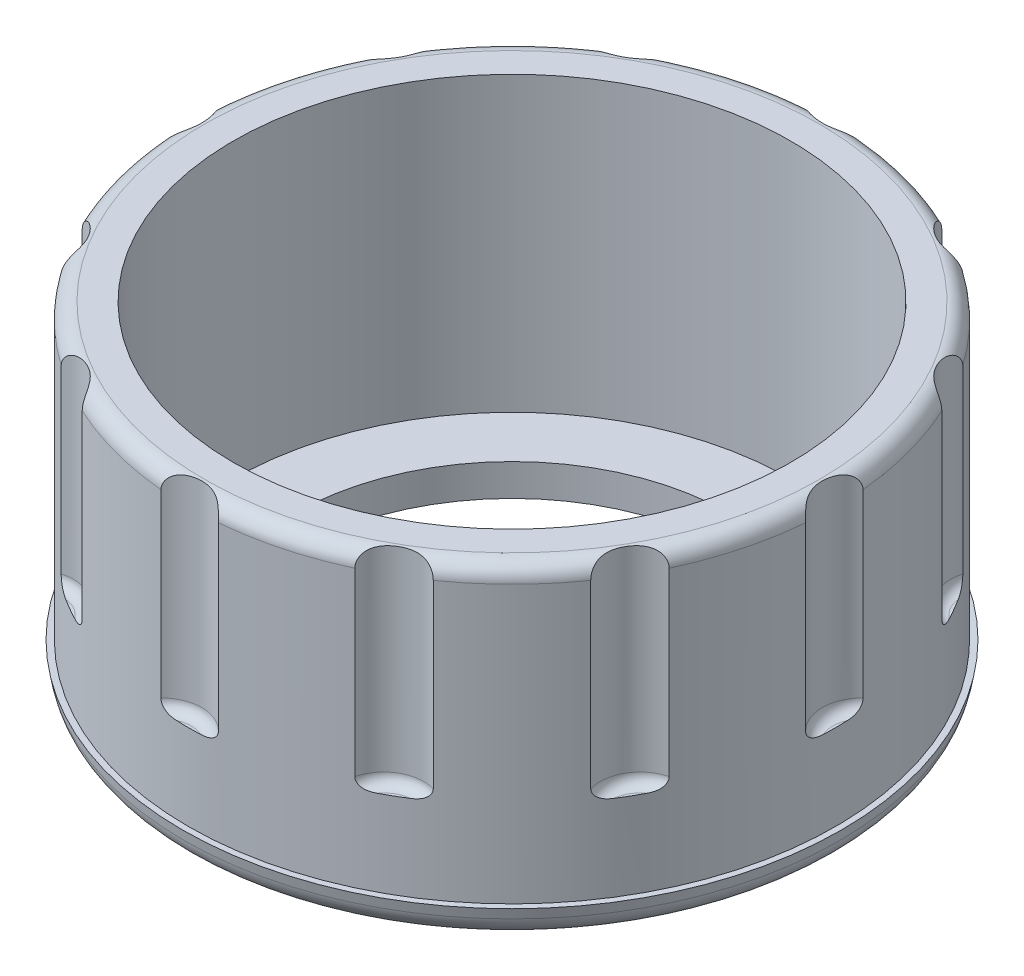
from build123d import *

# Parameters (mm, degrees)
SKETCH1_R                     = 15.4432
BOSS_EXTRUDE1_DEPTH           = 15.494
F_1_1_8_12_TAPPED_HOLE1_D     = 26.59126
F_1_1_8_12_TAPPED_HOLE1_DEPTH = 13.97
CUT_EXTRUDE1_START            = 15.494
SKETCH4_R                     = 1.905
CUT_EXTRUDE1_DEPTH            = 9.8806
FILLET2_R                     = 0.508
CIRPATTERN1_COUNT             = 12
FILLET2_OF_CIRPATTERN1_R      = 0.508
FILLET3_R                     = 0.762
SKETCH5_R                     = 10.414
CUT_EXTRUDE2_DEPTH            = 9.8806
FILLET4_R                     = 1.27


with BuildPart() as part:
    # Sketch1 → Boss-Extrude1 (new body)
    with BuildSketch(Plane(origin=(0, 0, 0), x_dir=(1, 0, 0), z_dir=(0, 1, 0))):
        with Locations(Location((0, 0, 0), (0, 0, 270))):
            Circle(SKETCH1_R)
    extrude(amount=BOSS_EXTRUDE1_DEPTH)

    # 1-1/8-12 Tapped Hole1
    with Locations(Plane(origin=(0, 15.494, 0), x_dir=(1, 0, 0), z_dir=(0, 1, 0))):
        with Locations((0, 0)):
            Hole(F_1_1_8_12_TAPPED_HOLE1_D / 2, depth=F_1_1_8_12_TAPPED_HOLE1_DEPTH)

    # Sketch4 → Cut-Extrude1 (cut)
    with BuildSketch(Plane(origin=(0, 0, 0), x_dir=(1, 0, 0), z_dir=(0, 1, 0)).offset(CUT_EXTRUDE1_START)):
        with Locations((0, 16.705203825)):
            Circle(SKETCH4_R)
    cut_extrude1 = extrude(amount=-CUT_EXTRUDE1_DEPTH, mode=Mode.SUBTRACT)

    # Fillet2
    fillet2_edges = [part.edges().sort_by_distance(p)[0] for p in [
        (0, 5.6134, -14.800203825),
    ]]
    fillet(fillet2_edges, radius=FILLET2_R)

    # CirPattern1: Cut-Extrude1 ×12 about axis
    cirpattern1_axis = Axis((0, 0, 0), (0, 1, 0))
    for i in range(1, CIRPATTERN1_COUNT):
        add(cut_extrude1.rotate(cirpattern1_axis, i * 360 / CIRPATTERN1_COUNT), mode=Mode.SUBTRACT)

    # Fillet2 of CirPattern1
    fillet2_of_cirpattern1_edges = [part.edges().sort_by_distance(p)[0] for p in [
        (-7.400101912, 5.6134, -12.817352494),
        (-12.817352494, 5.6134, -7.400101912),
        (-14.800203825, 5.6134, 0),
        (-12.817352494, 5.6134, 7.400101912),
        (-7.400101912, 5.6134, 12.817352494),
        (0, 5.6134, 14.800203825),
        (7.400101912, 5.6134, 12.817352494),
        (12.817352494, 5.6134, 7.400101912),
        (14.800203825, 5.6134, 0),
        (12.817352494, 5.6134, -7.400101912),
        (7.400101912, 5.6134, -12.817352494),
    ]]
    fillet(fillet2_of_cirpattern1_edges, radius=FILLET2_OF_CIRPATTERN1_R)

    # Fillet3
    # the kernel refuses this fillet: 0.762 mm, written as the material it takes off along each edge
    with BuildSketch(Plane(origin=(0, 15.494, 0), x_dir=(0.034476388157499746, 0, -0.9994055126221855), z_dir=(0.9994055126221855, 0, 0.034476388157499746))) as fillet3_piece_1:
        with BuildLine():
            CenterArc((15.4432 - FILLET3_R, -FILLET3_R), FILLET3_R, 0, 90)
            Line((15.4432 - FILLET3_R, 0), (15.4432, 0))
            Line((15.4432, 0), (15.4432, -FILLET3_R))
        make_face()
    revolve(axis=Axis((0, 15.494, 0), (0, 1, 0)), revolution_arc=33.951486136, mode=Mode.SUBTRACT)
    with BuildSketch(Plane(origin=(0, 15.494, 0), x_dir=(-0.4698453283359946, 0, -0.8827487566917562), z_dir=(0.8827487566917562, 0, -0.4698453283359946))) as fillet3_piece_2:
        with BuildLine():
            CenterArc((15.4432 - FILLET3_R, -FILLET3_R), FILLET3_R, 0, 90)
            Line((15.4432 - FILLET3_R, 0), (15.4432, 0))
            Line((15.4432, 0), (15.4432, -FILLET3_R))
        make_face()
    revolve(axis=Axis((0, 15.494, 0), (0, 1, 0)), revolution_arc=33.951486136, mode=Mode.SUBTRACT)
    with BuildSketch(Plane(origin=(0, 15.494, 0), x_dir=(-0.8482723685342893, 0, -0.5295601842861929), z_dir=(0.5295601842861929, 0, -0.8482723685342893))) as fillet3_piece_3:
        with BuildLine():
            CenterArc((15.4432 - FILLET3_R, -FILLET3_R), FILLET3_R, 0, 90)
            Line((15.4432 - FILLET3_R, 0), (15.4432, 0))
            Line((15.4432, 0), (15.4432, -FILLET3_R))
        make_face()
    revolve(axis=Axis((0, 15.494, 0), (0, 1, 0)), revolution_arc=33.951486136, mode=Mode.SUBTRACT)
    with BuildSketch(Plane(origin=(0, 15.494, 0), x_dir=(-0.9994055126221868, 0, -0.034476388157465204), z_dir=(0.034476388157465204, 0, -0.9994055126221868))) as fillet3_piece_4:
        with BuildLine():
            CenterArc((15.4432 - FILLET3_R, -FILLET3_R), FILLET3_R, 0, 90)
            Line((15.4432 - FILLET3_R, 0), (15.4432, 0))
            Line((15.4432, 0), (15.4432, -FILLET3_R))
        make_face()
    revolve(axis=Axis((0, 15.494, 0), (0, 1, 0)), revolution_arc=33.951486136, mode=Mode.SUBTRACT)
    with BuildSketch(Plane(origin=(0, 15.494, 0), x_dir=(-0.8827487566917557, 0, 0.46984532833599574), z_dir=(-0.46984532833599574, 0, -0.8827487566917557))) as fillet3_piece_5:
        with BuildLine():
            CenterArc((15.4432 - FILLET3_R, -FILLET3_R), FILLET3_R, 0, 90)
            Line((15.4432 - FILLET3_R, 0), (15.4432, 0))
            Line((15.4432, 0), (15.4432, -FILLET3_R))
        make_face()
    revolve(axis=Axis((0, 15.494, 0), (0, 1, 0)), revolution_arc=33.951486136, mode=Mode.SUBTRACT)
    with BuildSketch(Plane(origin=(0, 15.494, 0), x_dir=(-0.5295601842861937, 0, 0.8482723685342889), z_dir=(-0.8482723685342889, 0, -0.5295601842861937))) as fillet3_piece_6:
        with BuildLine():
            CenterArc((15.4432 - FILLET3_R, -FILLET3_R), FILLET3_R, 0, 90)
            Line((15.4432 - FILLET3_R, 0), (15.4432, 0))
            Line((15.4432, 0), (15.4432, -FILLET3_R))
        make_face()
    revolve(axis=Axis((0, 15.494, 0), (0, 1, 0)), revolution_arc=33.951486136, mode=Mode.SUBTRACT)
    with BuildSketch(Plane(origin=(0, 15.494, 0), x_dir=(-0.03447638815746288, 0, 0.9994055126221868), z_dir=(-0.9994055126221868, 0, -0.03447638815746288))) as fillet3_piece_7:
        with BuildLine():
            CenterArc((15.4432 - FILLET3_R, -FILLET3_R), FILLET3_R, 0, 90)
            Line((15.4432 - FILLET3_R, 0), (15.4432, 0))
            Line((15.4432, 0), (15.4432, -FILLET3_R))
        make_face()
    revolve(axis=Axis((0, 15.494, 0), (0, 1, 0)), revolution_arc=33.951486136, mode=Mode.SUBTRACT)
    with BuildSketch(Plane(origin=(0, 15.494, 0), x_dir=(0.4698453283359953, 0, 0.8827487566917558), z_dir=(-0.8827487566917558, 0, 0.4698453283359953))) as fillet3_piece_8:
        with BuildLine():
            CenterArc((15.4432 - FILLET3_R, -FILLET3_R), FILLET3_R, 0, 90)
            Line((15.4432 - FILLET3_R, 0), (15.4432, 0))
            Line((15.4432, 0), (15.4432, -FILLET3_R))
        make_face()
    revolve(axis=Axis((0, 15.494, 0), (0, 1, 0)), revolution_arc=33.951486136, mode=Mode.SUBTRACT)
    with BuildSketch(Plane(origin=(0, 15.494, 0), x_dir=(0.8482723685342883, 0, 0.5295601842861947), z_dir=(-0.5295601842861947, 0, 0.8482723685342883))) as fillet3_piece_9:
        with BuildLine():
            CenterArc((15.4432 - FILLET3_R, -FILLET3_R), FILLET3_R, 0, 90)
            Line((15.4432 - FILLET3_R, 0), (15.4432, 0))
            Line((15.4432, 0), (15.4432, -FILLET3_R))
        make_face()
    revolve(axis=Axis((0, 15.494, 0), (0, 1, 0)), revolution_arc=33.951486136, mode=Mode.SUBTRACT)
    with BuildSketch(Plane(origin=(0, 15.494, 0), x_dir=(0.9994055126221867, 0, 0.03447638815746685), z_dir=(-0.03447638815746685, 0, 0.9994055126221867))) as fillet3_piece_10:
        with BuildLine():
            CenterArc((15.4432 - FILLET3_R, -FILLET3_R), FILLET3_R, 0, 90)
            Line((15.4432 - FILLET3_R, 0), (15.4432, 0))
            Line((15.4432, 0), (15.4432, -FILLET3_R))
        make_face()
    revolve(axis=Axis((0, 15.494, 0), (0, 1, 0)), revolution_arc=33.951486136, mode=Mode.SUBTRACT)
    with BuildSketch(Plane(origin=(0, 15.494, 0), x_dir=(0.8827487566917563, 0, -0.46984532833599424), z_dir=(0.46984532833599424, 0, 0.8827487566917563))) as fillet3_piece_11:
        with BuildLine():
            CenterArc((15.4432 - FILLET3_R, -FILLET3_R), FILLET3_R, 0, 90)
            Line((15.4432 - FILLET3_R, 0), (15.4432, 0))
            Line((15.4432, 0), (15.4432, -FILLET3_R))
        make_face()
    revolve(axis=Axis((0, 15.494, 0), (0, 1, 0)), revolution_arc=33.951486136, mode=Mode.SUBTRACT)
    with BuildSketch(Plane(origin=(0, 15.494, 0), x_dir=(0.5295601842861954, 0, -0.8482723685342879), z_dir=(0.8482723685342879, 0, 0.5295601842861954))) as fillet3_piece_12:
        with BuildLine():
            CenterArc((15.4432 - FILLET3_R, -FILLET3_R), FILLET3_R, 0, 90)
            Line((15.4432 - FILLET3_R, 0), (15.4432, 0))
            Line((15.4432, 0), (15.4432, -FILLET3_R))
        make_face()
    revolve(axis=Axis((0, 15.494, 0), (0, 1, 0)), revolution_arc=33.951486136, mode=Mode.SUBTRACT)

    # Sketch5 → Cut-Extrude2 (cut)
    with BuildSketch(Plane(origin=(0, 0, 0), x_dir=(1, 0, 0), z_dir=(0, 1, 0))):
        with Locations(Location((0, 0, 0), (0, 0, 90))):
            Circle(SKETCH5_R)
    extrude(amount=CUT_EXTRUDE2_DEPTH, mode=Mode.SUBTRACT)

    # Sketch6 → Revolve1 (revolve)
    with BuildSketch(Plane.XY, mode=Mode.PRIVATE) as revolve1_sk:
        Polygon((-15.4432, 0), (-15.4432, 1.524), (-15.72556189, 1.524), align=None)
    revolve(revolve1_sk.sketch.rotate(Axis((0, 15.494, 0), (0, -1, 0)), 270), axis=Axis((0, 15.494, 0), (0, -1, 0)))

    # Fillet4
    fillet4_edges = [part.edges().sort_by_distance(p)[0] for p in [
        (0, 0, -15.4432),
    ]]
    fillet(fillet4_edges, radius=FILLET4_R)


solid = part.part
